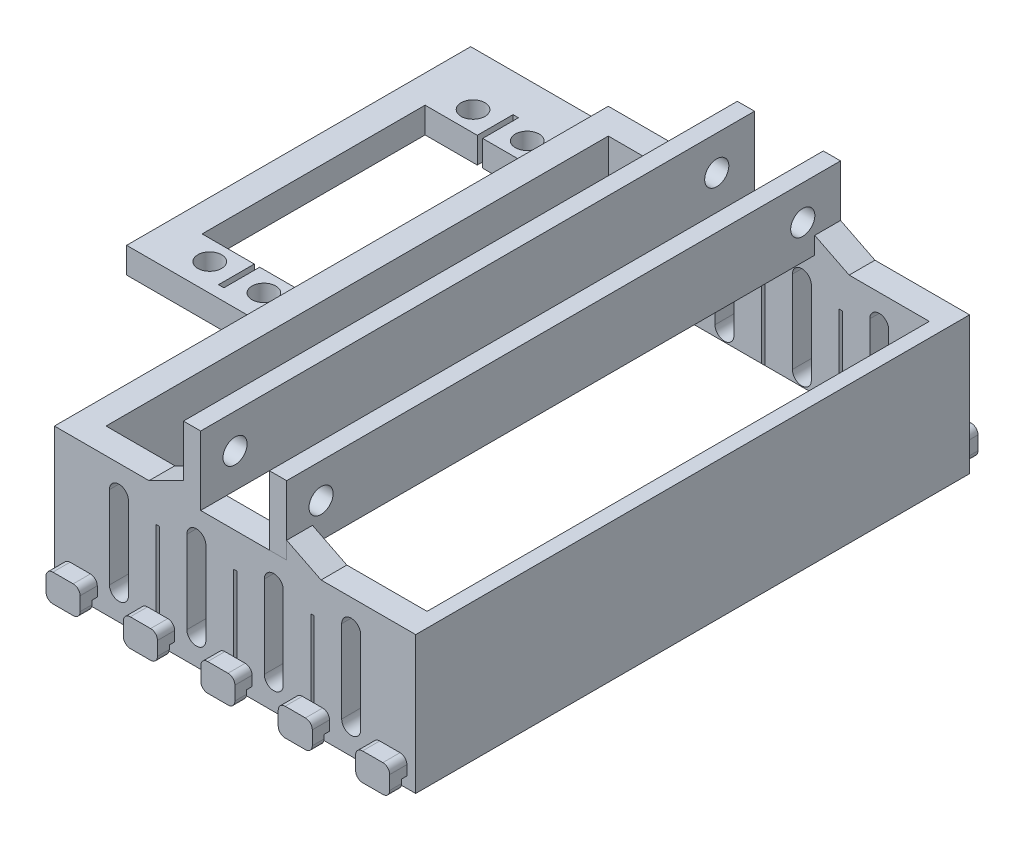
from build123d import *

# Parameters (mm, degrees)
SKETCH4_W               = 66.675
SKETCH4_H               = 102.22500002
SKETCH4_W_2             = 57.15
SKETCH4_H_2             = 92.70000002
BOSS_EXTRUDE1_DEPTH     = 19.05
BOSS_EXTRUDE2_START     = 19.05
SKETCH5_W               = 66.675
SKETCH5_H               = 102.22500002
BOSS_EXTRUDE2_DEPTH     = 6.35
FILLET1_SIZE            = 3.175
SKETCH6_W               = 0.635
SKETCH6_H               = 19.05
CUT_EXTRUDE_THIN1_DEPTH = 116.623642921
SKETCH8_W               = 3.175
SKETCH8_H               = 12.7
BOSS_EXTRUDE3_DEPTH     = 102.22500002
BOSS_EXTRUDE3_2_DEPTH   = 102.22500002
SKETCH9_R               = 2.226999991
CUT_EXTRUDE2_DEPTH      = 77.819864381
SKETCH14_W              = 57.15
SKETCH14_H              = 92.70000002
CUT_EXTRUDE8_DEPTH      = 6.35
CUT_EXTRUDE9_DEPTH      = 115.074315844
BOSS_EXTRUDE4_DEPTH     = 4.7625
BOSS_EXTRUDE5_START     = -97.4625
BOSS_EXTRUDE5_DEPTH     = 4.7625
BOSS_EXTRUDE6_DEPTH     = 3.175
LPATTERN1_COUNT         = 3
LPATTERN1_PITCH         = 14.2875
LPATTERN1_COL_COUNT     = 3
LPATTERN1_COL_PITCH     = 14.2875
SKETCH36_W              = 1
SKETCH36_H              = 2
CUT_EXTRUDE12_DEPTH     = 93.903489285
MIRROR3_START           = -54.28750001
MIRROR3_DEPTH           = 2.175
MIRROR3_START_2         = -52.11250001
MIRROR3_2_DEPTH         = 1
BOSS_EXTRUDE7_START     = -3.175
SKETCH19_R              = 2.200000045
BOSS_EXTRUDE7_DEPTH     = 4.7625
CUT_EXTRUDE11_REACH     = 85.919
SKETCH26_W              = 2.0955
SKETCH26_H              = 92.70000002
BOSS_EXTRUDE16_START    = -63.5
BOSS_EXTRUDE16_DEPTH    = 3.175


# Read off the part's stored shape, not the designer's step: Mirror3
with BuildPart() as part:
    # Sketch4 → Boss-Extrude1 (new body)
    with BuildSketch(Plane(origin=(0, 0, 0), x_dir=(1, 0, 0), z_dir=(0, 1, 0))):
        Rectangle(SKETCH4_W, SKETCH4_H)
        Rectangle(SKETCH4_W_2, SKETCH4_H_2, mode=Mode.SUBTRACT)
    extrude(amount=BOSS_EXTRUDE1_DEPTH)

    # Sketch5 → Boss-Extrude2 (add)
    with BuildSketch(Plane(origin=(0, 0, 0), x_dir=(1, 0, 0), z_dir=(0, 1, 0)).offset(BOSS_EXTRUDE2_START)):
        Rectangle(SKETCH5_W, SKETCH5_H)
    extrude(amount=BOSS_EXTRUDE2_DEPTH)

    # Fillet1
    fillet1_edges = [part.edges().sort_by_distance(p)[0] for p in [
        (-28.575, 0, 0),
        (0, 0, 46.35000001),
        (28.575, 0, 0),
        (0, 0, -46.35000001),
    ]]
    chamfer(fillet1_edges, length=FILLET1_SIZE)

    # Sketch6 → Cut-Extrude-Thin1 (cut, through all)
    with BuildSketch(Plane(origin=(14.34600001, 0, 51.11250001), x_dir=(-1, 0, 0), z_dir=(0, 0, -1))):
        with Locations((14.34600001, 9.525)):
            Rectangle(SKETCH6_W, SKETCH6_H)
        with Locations((28.63350001, 9.525)):
            Rectangle(SKETCH6_W, SKETCH6_H)
        with Locations((0.05850001, 9.525)):
            Rectangle(SKETCH6_W, SKETCH6_H)
    extrude(amount=CUT_EXTRUDE_THIN1_DEPTH, mode=Mode.SUBTRACT)

    # Sketch14 → Cut-Extrude8 (cut)
    with BuildSketch(Plane.XZ.offset(-19.05)):
        Rectangle(SKETCH14_W, SKETCH14_H)
    extrude(amount=-CUT_EXTRUDE8_DEPTH, mode=Mode.SUBTRACT)

    # Sketch12 → Cut-Extrude9 (cut, through all)
    with BuildSketch(Plane.XY.offset(51.11250001)):
        with BuildLine():
            Line((-5.393749944, 20.32), (-5.393749944, 5.08))
            ThreePointArc((-5.393749944, 5.08), (-7.14375, 3.329999944), (-8.893750056, 5.08))
            Line((-8.893750056, 5.08), (-8.893750056, 20.32))
            ThreePointArc((-8.893750056, 20.32), (-7.14375, 22.070000056), (-5.393749944, 20.32))
        make_face()
        with BuildLine():
            Line((-19.681249944, 20.32), (-19.681249944, 5.08))
            ThreePointArc((-19.681249944, 5.08), (-21.43125, 3.329999944), (-23.181250056, 5.08))
            Line((-23.181250056, 5.08), (-23.181250056, 20.32))
            ThreePointArc((-23.181250056, 20.32), (-21.43125, 22.070000056), (-19.681249944, 20.32))
        make_face()
        with BuildLine():
            Line((5.393749944, 20.32), (5.393749944, 5.08))
            ThreePointArc((5.393749944, 5.08), (7.14375, 3.329999944), (8.893750056, 5.08))
            Line((8.893750056, 5.08), (8.893750056, 20.32))
            ThreePointArc((8.893750056, 20.32), (7.14375, 22.070000056), (5.393749944, 20.32))
        make_face()
        with BuildLine():
            Line((19.681249944, 20.32), (19.681249944, 5.08))
            ThreePointArc((19.681249944, 5.08), (21.43125, 3.329999944), (23.181250056, 5.08))
            Line((23.181250056, 5.08), (23.181250056, 20.32))
            ThreePointArc((23.181250056, 20.32), (21.43125, 22.070000056), (19.681249944, 20.32))
        make_face()
    extrude(amount=-CUT_EXTRUDE9_DEPTH, mode=Mode.SUBTRACT)


with BuildPart() as body_2:
    # Sketch8 → Boss-Extrude3 (new body)
    with BuildSketch(Plane.XY.offset(51.11250001)):
        with Locations((-7.9375, 31.75)):
            Rectangle(SKETCH8_W, SKETCH8_H)
    extrude(amount=-BOSS_EXTRUDE3_DEPTH)


with BuildPart() as body_3:
    # Sketch8 → Boss-Extrude3 2 (new body)
    with BuildSketch(Plane.XY.offset(51.11250001)):
        with Locations((7.9375, 31.75)):
            Rectangle(SKETCH8_W, SKETCH8_H)
    extrude(amount=-BOSS_EXTRUDE3_2_DEPTH)


with BuildPart() as cut_extrude2_tool:
    # Sketch9 → Cut-Extrude2 (new, through all)
    with BuildSketch(Plane.ZY.offset(9.525)):
        with Locations((44.76250001, 31.75)):
            Circle(SKETCH9_R)
        with Locations((-44.13749999, 31.75)):
            Circle(SKETCH9_R)
    extrude(amount=-CUT_EXTRUDE2_DEPTH)


with BuildPart() as body_2_1:
    add(body_2.part)

    # Cut-Extrude2: cut by cut_extrude2_tool
    add(cut_extrude2_tool.part, mode=Mode.SUBTRACT)


    add(part.part)  # Boss-Extrude4 merges part
    # Sketch15 → Boss-Extrude4 (add)
    with BuildSketch(Plane(origin=(0, 0, -51.11250001), x_dir=(-1, 0, 0), z_dir=(0, 0, -1))):
        Polygon((-9.525, 28.575), (-15.875, 25.4), (-9.525, 25.4), align=None)
        Polygon((9.525, 28.575), (9.525, 25.4), (15.875, 25.4), align=None)
    extrude(amount=-BOSS_EXTRUDE4_DEPTH)

    # Sketch15<2> → Boss-Extrude5 (add)
    with BuildSketch(Plane(origin=(0, 0, -51.11250001), x_dir=(-1, 0, 0), z_dir=(0, 0, -1)).offset(BOSS_EXTRUDE5_START)):
        Polygon((-9.525, 28.575), (-15.875, 25.4), (-9.525, 25.4), align=None)
        Polygon((9.525, 28.575), (9.525, 25.4), (15.875, 25.4), align=None)
    extrude(amount=-BOSS_EXTRUDE5_DEPTH)

    # Sketch16 → Boss-Extrude6 (add)
    with BuildSketch(Plane.XY.offset(51.11250001)):
        with BuildLine():
            Line((-1.873749999, 5.08), (1.873749999, 5.08))
            ThreePointArc((1.873749999, 5.08), (2.771775611, 4.708025612), (3.143749999, 3.81))
            Line((3.143749999, 3.81), (3.143749999, 1.27))
            ThreePointArc((3.143749999, 1.27), (2.771775611, 0.371974388), (1.873749999, 0))
            Line((1.873749999, 0), (-1.873749999, 0))
            ThreePointArc((-1.873749999, 0), (-2.771775611, 0.371974388), (-3.143749999, 1.27))
            Line((-3.143749999, 1.27), (-3.143749999, 3.81))
            ThreePointArc((-3.143749999, 3.81), (-2.771775611, 4.708025612), (-1.873749999, 5.08))
        make_face()
    boss_extrude6 = extrude(amount=BOSS_EXTRUDE6_DEPTH)

    # LPattern1: Boss-Extrude6 ×3
    with Locations(*[(i * LPATTERN1_PITCH, 0, 0) for i in range(1, LPATTERN1_COUNT)]):
        add(boss_extrude6)

    # LPattern1 col: Boss-Extrude6 ×3
    with Locations(*[(-i * LPATTERN1_COL_PITCH, 0, 0) for i in range(1, LPATTERN1_COL_COUNT)]):
        add(boss_extrude6)

    # Sketch36 → Cut-Extrude12 (cut, through all)
    with BuildSketch(Plane(origin=(31.718749999, 0, 0), x_dir=(0, 0, -1), z_dir=(1, 0, 0))):
        with Locations((-51.61250001, 1)):
            Rectangle(SKETCH36_W, SKETCH36_H)
    extrude(amount=-CUT_EXTRUDE12_DEPTH, mode=Mode.SUBTRACT)



with BuildPart() as body_3_1:
    add(body_3.part)

    # Cut-Extrude2: cut by cut_extrude2_tool
    add(cut_extrude2_tool.part, mode=Mode.SUBTRACT)


with BuildPart() as body_3_2:
    # Mirror3 outline → Mirror3 (new body)
    with BuildSketch(Plane.XY.offset(MIRROR3_START)):
        with BuildLine():
            Line((-30.448749999, 0), (-26.701250001, 0))
            ThreePointArc((-26.701250001, 0), (-25.803224389, 0.371974388), (-25.431250001, 1.27))
            Line((-25.431250001, 1.27), (-25.431250001, 3.81))
            ThreePointArc((-25.431250001, 3.81), (-25.803224389, 4.708025612), (-26.701250001, 5.08))
            Line((-26.701250001, 5.08), (-30.448749999, 5.08))
            ThreePointArc((-30.448749999, 5.08), (-31.346775611, 4.708025612), (-31.718749999, 3.81))
            Line((-31.718749999, 3.81), (-31.718749999, 1.27))
            ThreePointArc((-31.718749999, 1.27), (-31.346775611, 0.371974388), (-30.448749999, 0))
        make_face()
        with BuildLine():
            Line((-16.161249999, 0), (-12.413750001, 0))
            ThreePointArc((-12.413750001, 0), (-11.515724389, 0.371974388), (-11.143750001, 1.27))
            Line((-11.143750001, 1.27), (-11.143750001, 3.81))
            ThreePointArc((-11.143750001, 3.81), (-11.515724389, 4.708025612), (-12.413750001, 5.08))
            Line((-12.413750001, 5.08), (-16.161249999, 5.08))
            ThreePointArc((-16.161249999, 5.08), (-17.059275611, 4.708025612), (-17.431249999, 3.81))
            Line((-17.431249999, 3.81), (-17.431249999, 1.27))
            ThreePointArc((-17.431249999, 1.27), (-17.059275611, 0.371974388), (-16.161249999, 0))
        make_face()
        with BuildLine():
            Line((-1.873749999, 0), (1.873749999, 0))
            ThreePointArc((1.873749999, 0), (2.771775611, 0.371974388), (3.143749999, 1.27))
            Line((3.143749999, 1.27), (3.143749999, 3.81))
            ThreePointArc((3.143749999, 3.81), (2.771775611, 4.708025612), (1.873749999, 5.08))
            Line((1.873749999, 5.08), (-1.873749999, 5.08))
            ThreePointArc((-1.873749999, 5.08), (-2.771775611, 4.708025612), (-3.143749999, 3.81))
            Line((-3.143749999, 3.81), (-3.143749999, 1.27))
            ThreePointArc((-3.143749999, 1.27), (-2.771775611, 0.371974388), (-1.873749999, 0))
        make_face()
        with BuildLine():
            Line((12.413750001, 0), (16.161249999, 0))
            ThreePointArc((16.161249999, 0), (17.059275611, 0.371974388), (17.431249999, 1.27))
            Line((17.431249999, 1.27), (17.431249999, 3.81))
            ThreePointArc((17.431249999, 3.81), (17.059275611, 4.708025612), (16.161249999, 5.08))
            Line((16.161249999, 5.08), (12.413750001, 5.08))
            ThreePointArc((12.413750001, 5.08), (11.515724389, 4.708025612), (11.143750001, 3.81))
            Line((11.143750001, 3.81), (11.143750001, 1.27))
            ThreePointArc((11.143750001, 1.27), (11.515724389, 0.371974388), (12.413750001, 0))
        make_face()
        with BuildLine():
            Line((26.701250001, 0), (30.448749999, 0))
            ThreePointArc((30.448749999, 0), (31.346775611, 0.371974388), (31.718749999, 1.27))
            Line((31.718749999, 1.27), (31.718749999, 3.81))
            ThreePointArc((31.718749999, 3.81), (31.346775611, 4.708025612), (30.448749999, 5.08))
            Line((30.448749999, 5.08), (26.701250001, 5.08))
            ThreePointArc((26.701250001, 5.08), (25.803224389, 4.708025612), (25.431250001, 3.81))
            Line((25.431250001, 3.81), (25.431250001, 1.27))
            ThreePointArc((25.431250001, 1.27), (25.803224389, 0.371974388), (26.701250001, 0))
        make_face()
    extrude(amount=MIRROR3_DEPTH)


with BuildPart() as body_2_2:
    add(body_2_1.part)

    add(body_3_2.part)  # Mirror3 2 merges body 3 2
    # Mirror3 2 outline → Mirror3 2 (add)
    with BuildSketch(Plane.XY.offset(MIRROR3_START_2)):
        with BuildLine():
            Line((-31.718749999, 2), (-25.431250001, 2))
            Line((-25.431250001, 2), (-25.431250001, 3.81))
            ThreePointArc((-25.431250001, 3.81), (-25.803224389, 4.708025612), (-26.701250001, 5.08))
            Line((-26.701250001, 5.08), (-30.448749999, 5.08))
            ThreePointArc((-30.448749999, 5.08), (-31.346775611, 4.708025612), (-31.718749999, 3.81))
            Line((-31.718749999, 3.81), (-31.718749999, 2))
        make_face()
        with BuildLine():
            Line((-17.431249999, 2), (-11.143750001, 2))
            Line((-11.143750001, 2), (-11.143750001, 3.81))
            ThreePointArc((-11.143750001, 3.81), (-11.515724389, 4.708025612), (-12.413750001, 5.08))
            Line((-12.413750001, 5.08), (-16.161249999, 5.08))
            ThreePointArc((-16.161249999, 5.08), (-17.059275611, 4.708025612), (-17.431249999, 3.81))
            Line((-17.431249999, 3.81), (-17.431249999, 2))
        make_face()
        with BuildLine():
            Line((-3.143749999, 2), (3.143749999, 2))
            Line((3.143749999, 2), (3.143749999, 3.81))
            ThreePointArc((3.143749999, 3.81), (2.771775611, 4.708025612), (1.873749999, 5.08))
            Line((1.873749999, 5.08), (-1.873749999, 5.08))
            ThreePointArc((-1.873749999, 5.08), (-2.771775611, 4.708025612), (-3.143749999, 3.81))
            Line((-3.143749999, 3.81), (-3.143749999, 2))
        make_face()
        with BuildLine():
            Line((11.143750001, 2), (17.431249999, 2))
            Line((17.431249999, 2), (17.431249999, 3.81))
            ThreePointArc((17.431249999, 3.81), (17.059275611, 4.708025612), (16.161249999, 5.08))
            Line((16.161249999, 5.08), (12.413750001, 5.08))
            ThreePointArc((12.413750001, 5.08), (11.515724389, 4.708025612), (11.143750001, 3.81))
            Line((11.143750001, 3.81), (11.143750001, 2))
        make_face()
        with BuildLine():
            Line((25.431250001, 2), (31.718749999, 2))
            Line((31.718749999, 2), (31.718749999, 3.81))
            ThreePointArc((31.718749999, 3.81), (31.346775611, 4.708025612), (30.448749999, 5.08))
            Line((30.448749999, 5.08), (26.701250001, 5.08))
            ThreePointArc((26.701250001, 5.08), (25.803224389, 4.708025612), (25.431250001, 3.81))
            Line((25.431250001, 3.81), (25.431250001, 2))
        make_face()
    extrude(amount=MIRROR3_2_DEPTH)

    # Cut-Extrude11: up to this plane
    cut_extrude11_end = Plane(origin=(31.75, 0, 0), z_dir=(-0.7071067811865479, -0.7071067811865471, 0))
    # Sketch26 → Cut-Extrude11 (cut, up to the surface)
    with BuildSketch(Plane(origin=(0, 25.4, 0), x_dir=(1, 0, 0), z_dir=(0, 1, 0)), mode=Mode.PRIVATE) as cut_extrude11_sk1:
        with Locations((29.62275, 0)):
            Rectangle(SKETCH26_W, SKETCH26_H)
    cut_extrude11_tool1 = split(extrude(cut_extrude11_sk1.sketch, amount=-CUT_EXTRUDE11_REACH, mode=Mode.PRIVATE), bisect_by=cut_extrude11_end, keep=Keep.BOTH, mode=Mode.PRIVATE)
    add(cut_extrude11_tool1.solids().sort_by_distance((29.62275, 25.4, 0))[0], mode=Mode.SUBTRACT)



with BuildPart() as body_3_3:
    # Sketch19 → Boss-Extrude7 (new body)
    with BuildSketch(Plane(origin=(0, 25.4, 0), x_dir=(1, 0, 0), z_dir=(0, 1, 0)).offset(BOSS_EXTRUDE7_START)):
        Polygon((-33.3375, 37.554000076), (-33.3375, 51.11250001), (-58.7375, 51.11250001), (-58.7375, -12.38749999), (-33.3375, -12.38749999), (-33.3375, -3.599999912), (-42.964499939, -3.599999912), (-42.964499939, -10.203999912), (-43.964499939, -10.203999912), (-43.964499939, -3.599999912), (-53.591499878, -3.599999912), (-53.591499878, 37.554000076), (-43.964499939, 37.554000076), (-43.964499939, 44.158000076), (-42.964499939, 44.158000076), (-42.964499939, 37.554000076), align=None)
        with Locations(Location((-48.464499972, -7.322999959, 0), (0, 0, 270))):
            Circle(SKETCH19_R, mode=Mode.SUBTRACT)
        with Locations(Location((-38.464499906, -7.322999959, 0), (0, 0, 270))):
            Circle(SKETCH19_R, mode=Mode.SUBTRACT)
        with Locations(Location((-48.464499972, 41.277000123, 0), (0, 0, 270))):
            Circle(SKETCH19_R, mode=Mode.SUBTRACT)
        with Locations(Location((-38.464499906, 41.277000123, 0), (0, 0, 270))):
            Circle(SKETCH19_R, mode=Mode.SUBTRACT)
    extrude(amount=-BOSS_EXTRUDE7_DEPTH)


with BuildPart() as body_2_3:
    add(body_2_2.part)

    add(body_3_3.part)  # Boss-Extrude16 merges body 3 3
    # Sketch35 → Boss-Extrude16 (add)
    with BuildSketch(Plane.XY.offset(12.38749999).offset(BOSS_EXTRUDE16_START)):
        Polygon((-58.7375, 17.4625), (-33.3375, 17.4625), (-33.3375, 4.7625), align=None)
    extrude(amount=BOSS_EXTRUDE16_DEPTH)


solid = Compound([body_3_1.part, body_2_3.part])
